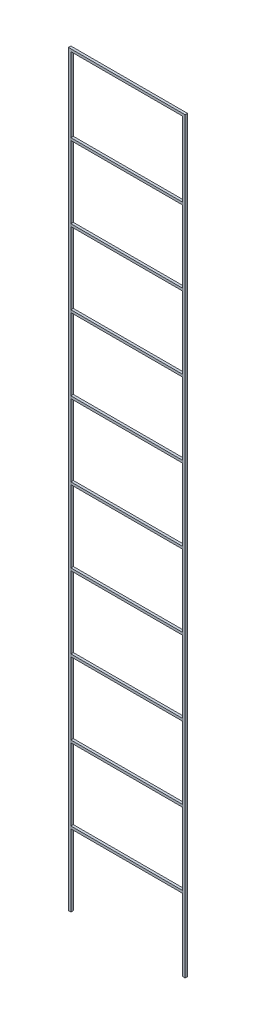
from build123d import *

# Parameters (mm, degrees)
EXTRUDE_THIN1_DEPTH    = 10
SKETCH2_W              = 457.2
SKETCH2_H              = 10
EXTRUDE_THIN1_2_DEPTH  = 10
EXTRUDE_THIN1_3_DEPTH  = 10
EXTRUDE_THIN1_4_DEPTH  = 10
EXTRUDE_THIN1_5_DEPTH  = 10
EXTRUDE_THIN1_6_DEPTH  = 10
EXTRUDE_THIN1_7_DEPTH  = 10
EXTRUDE_THIN1_8_DEPTH  = 10
EXTRUDE_THIN1_9_DEPTH  = 10
EXTRUDE_THIN1_10_DEPTH = 10


with BuildPart() as part:
    # Sketch2 → Extrude-Thin1 (new body)
    with BuildSketch(Plane.XY):
        Polygon((-457.2, -3140.375504184), (-457.2, -92.375504184), (0, -92.375504184), (0, -3140.375504184), (10, -3140.375504184), (10, -82.375504184), (-467.2, -82.375504184), (-467.2, -3140.375504184), align=None)
    extrude(amount=EXTRUDE_THIN1_DEPTH)


with BuildPart() as body_2:
    # Sketch2 → Extrude-Thin1 2 (new body)
    with BuildSketch(Plane.XY):
        with Locations((-228.6, -402.175504184)):
            Rectangle(SKETCH2_W, SKETCH2_H)
    extrude(amount=EXTRUDE_THIN1_2_DEPTH)


with BuildPart() as body_3:
    # Sketch2 → Extrude-Thin1 3 (new body)
    with BuildSketch(Plane.XY):
        with Locations((-228.6, -1621.375504184)):
            Rectangle(SKETCH2_W, SKETCH2_H)
    extrude(amount=EXTRUDE_THIN1_3_DEPTH)


with BuildPart() as body_4:
    # Sketch2 → Extrude-Thin1 4 (new body)
    with BuildSketch(Plane.XY):
        with Locations((-228.6, -2535.775504184)):
            Rectangle(SKETCH2_W, SKETCH2_H)
    extrude(amount=EXTRUDE_THIN1_4_DEPTH)


with BuildPart() as body_5:
    # Sketch2 → Extrude-Thin1 5 (new body)
    with BuildSketch(Plane.XY):
        with Locations((-228.6, -706.975504184)):
            Rectangle(SKETCH2_W, SKETCH2_H)
    extrude(amount=EXTRUDE_THIN1_5_DEPTH)


with BuildPart() as body_6:
    # Sketch2 → Extrude-Thin1 6 (new body)
    with BuildSketch(Plane.XY):
        with Locations((-228.6, -2230.975504184)):
            Rectangle(SKETCH2_W, SKETCH2_H)
    extrude(amount=EXTRUDE_THIN1_6_DEPTH)


with BuildPart() as body_7:
    # Sketch2 → Extrude-Thin1 7 (new body)
    with BuildSketch(Plane.XY):
        with Locations((-228.6, -1011.775504184)):
            Rectangle(SKETCH2_W, SKETCH2_H)
    extrude(amount=EXTRUDE_THIN1_7_DEPTH)


with BuildPart() as body_8:
    # Sketch2 → Extrude-Thin1 8 (new body)
    with BuildSketch(Plane.XY):
        with Locations((-228.6, -1316.575504184)):
            Rectangle(SKETCH2_W, SKETCH2_H)
    extrude(amount=EXTRUDE_THIN1_8_DEPTH)


with BuildPart() as body_9:
    # Sketch2 → Extrude-Thin1 9 (new body)
    with BuildSketch(Plane.XY):
        with Locations((-228.6, -1926.175504184)):
            Rectangle(SKETCH2_W, SKETCH2_H)
    extrude(amount=EXTRUDE_THIN1_9_DEPTH)


with BuildPart() as body_10:
    # Sketch2 → Extrude-Thin1 10 (new body)
    with BuildSketch(Plane.XY):
        with Locations((-228.6, -2840.575504184)):
            Rectangle(SKETCH2_W, SKETCH2_H)
    extrude(amount=EXTRUDE_THIN1_10_DEPTH)


solid = Compound([part.part, body_2.part, body_3.part, body_4.part, body_5.part, body_6.part, body_7.part, body_8.part, body_9.part, body_10.part])
